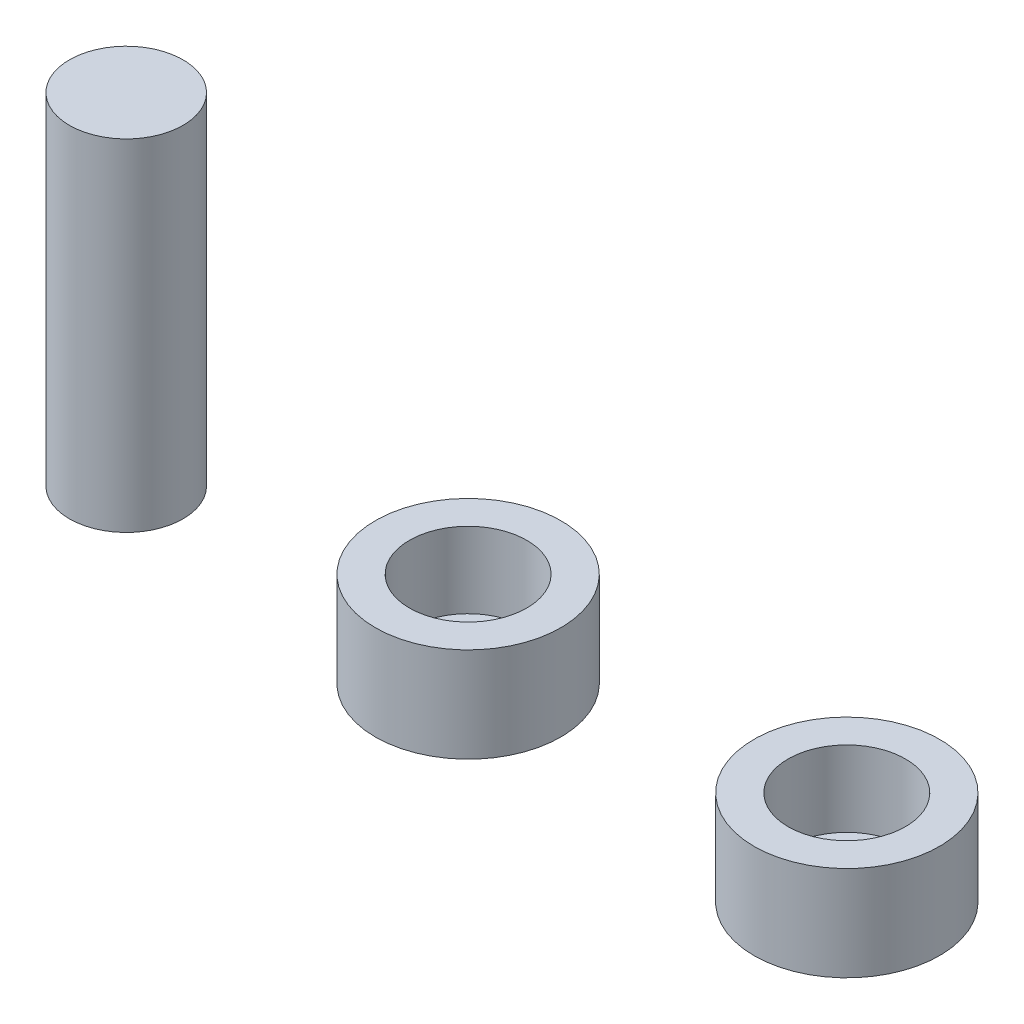
from build123d import *

# Parameters (mm, degrees)
SKETCH1_R           = 2.45
BOSS_EXTRUDE1_DEPTH = 2.5
SKETCH2_R           = 1.5
BOSS_EXTRUDE2_DEPTH = 9
SKETCH4_R           = 1.55
CUT_EXTRUDE1_DEPTH  = 2


with BuildPart() as part:
    # Sketch1 → Boss-Extrude1 (new body)
    with BuildSketch(Plane(origin=(0, 0, 0), x_dir=(1, 0, 0), z_dir=(0, 1, 0))):
        Circle(SKETCH1_R)
    extrude(amount=BOSS_EXTRUDE1_DEPTH)

    # Sketch4 → Cut-Extrude1 (cut)
    with BuildSketch(Plane(origin=(0, 2.5, 0), x_dir=(1, 0, 0), z_dir=(0, 1, 0))):
        Circle(SKETCH4_R)
    extrude(amount=-CUT_EXTRUDE1_DEPTH, mode=Mode.SUBTRACT)


with BuildPart() as body_2:
    # Sketch2 → Boss-Extrude2 (new body)
    with BuildSketch(Plane(origin=(0, 0, 0), x_dir=(1, 0, 0), z_dir=(0, 1, 0))):
        with Locations((-9.027296586, 0)):
            Circle(SKETCH2_R)
    extrude(amount=BOSS_EXTRUDE2_DEPTH)


with BuildPart() as body_3:
    # Mirror1: mirrored copy
    add(part.part.mirror(Plane(origin=(5, 0, 0), x_dir=(0, 0, 1), z_dir=(1, 0, 0))))


solid = Compound([part.part, body_2.part, body_3.part])
